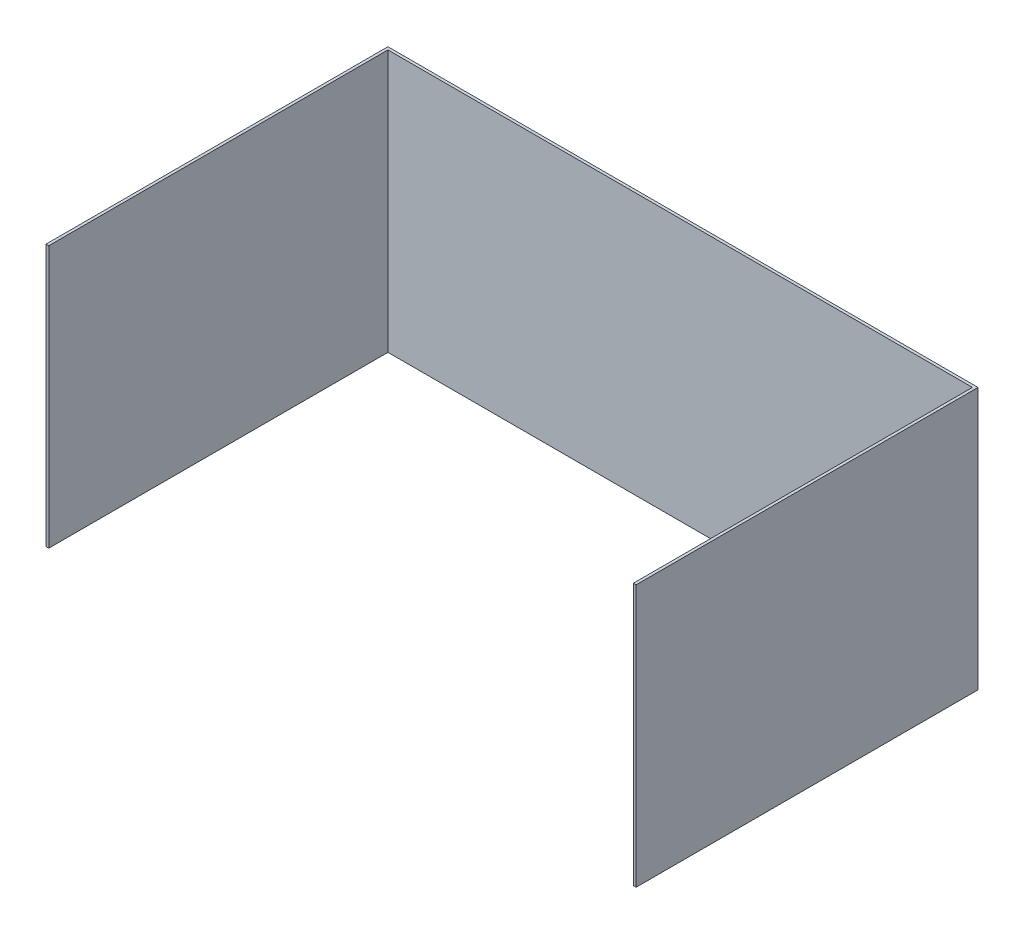
from build123d import *

# Parameters (mm, degrees)
EXTRUDE_THIN1_DEPTH = 301.625


with BuildPart() as part:
    # Sketch1 → Extrude-Thin1 (new body)
    with BuildSketch(Plane(origin=(0, 0, 0), x_dir=(1, 0, 0), z_dir=(0, 1, 0))):
        Polygon((-339.725, -196.85), (-339.725, 196.85), (339.725, 196.85), (339.725, -196.85), (336.55, -196.85), (336.55, 193.675), (-336.55, 193.675), (-336.55, -196.85), align=None)
    extrude(amount=EXTRUDE_THIN1_DEPTH)


solid = part.part
